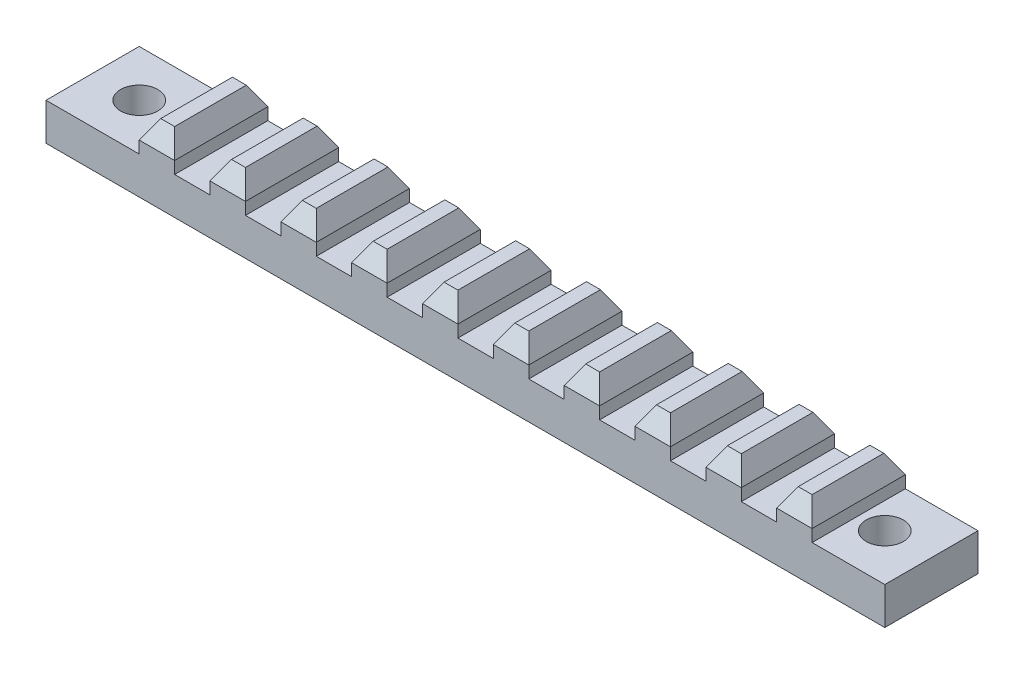
from build123d import *

# Parameters (mm, degrees)
SKETCH1_W                    = 45
SKETCH1_H                    = 5
SKETCH1_R                    = 1
BOSS_EXTRUDE1_DEPTH          = 2
SKETCH2_W                    = 1.9
SKETCH2_H                    = 1.65
BOSS_EXTRUDE2_DEPTH          = 5
CHAMFER1_SIZE                = 1
CHAMFER1_SIZE_2              = 0.577350269
LPATTERN1_COUNT              = 10
LPATTERN1_PITCH              = 3.8
CHAMFER1_OF_LPATTERN1_SIZE   = 1
CHAMFER1_OF_LPATTERN1_SIZE_2 = 0.577350269


with BuildPart() as part:
    # Sketch1 → Boss-Extrude1 (new body)
    with BuildSketch(Plane(origin=(0, 0, 0), x_dir=(1, 0, 0), z_dir=(0, 1, 0))):
        with Locations((22.5, -2.5)):
            Rectangle(SKETCH1_W, SKETCH1_H)
        with Locations(Location((2.5, -2.5, 0), (0, 0, 270))):
            Circle(SKETCH1_R, mode=Mode.SUBTRACT)
        with Locations(Location((42.5, -2.5, 0), (0, 0, 270))):
            Circle(SKETCH1_R, mode=Mode.SUBTRACT)
    extrude(amount=BOSS_EXTRUDE1_DEPTH)

    # Sketch2 → Boss-Extrude2 (add)
    with BuildSketch(Plane.XY.offset(5)):
        with Locations((5.95, 2.825)):
            Rectangle(SKETCH2_W, SKETCH2_H)
    boss_extrude2 = extrude(amount=-BOSS_EXTRUDE2_DEPTH)

    # Chamfer1
    # the kernel refuses this chamfer: 1, 0.577350269 mm, written as the material it takes off along each edge
    with BuildSketch(Plane(origin=(2.412914245, 3.65, 0), x_dir=(0, -0.9998132206222079, -0.019326765612700737), z_dir=(1, 0, 0))) as chamfer1_piece_1:
        Polygon((CHAMFER1_SIZE * 0.999813220622, -CHAMFER1_SIZE * 0.0193267656127), (-CHAMFER1_SIZE_2 * 0.019326765619, -CHAMFER1_SIZE_2 * 0.999813220951), (0, 0), align=None)
    extrude(amount=7.074171509, mode=Mode.SUBTRACT)
    with BuildSketch(Plane(origin=(2.412914245, 3.65, 5), x_dir=(0, -0.9998132206222079, 0.01932676561270115), z_dir=(1, 0, 0))) as chamfer1_piece_2:
        Polygon((CHAMFER1_SIZE * 0.999813220622, CHAMFER1_SIZE * 0.0193267656127), (-CHAMFER1_SIZE_2 * 0.019326765619, CHAMFER1_SIZE_2 * 0.999813220951), (0, 0), align=None)
    extrude(amount=7.074171509, mode=Mode.SUBTRACT)
    with BuildSketch(Plane(origin=(6.9, 3.65, 7.587085755), x_dir=(-0.9983227437537925, 0.0578938624026711, 0), z_dir=(0, 0, -1))) as chamfer1_piece_3:
        Polygon((CHAMFER1_SIZE_2 * 0.998322744082, -CHAMFER1_SIZE_2 * 0.0578938624217), (-CHAMFER1_SIZE * 0.0578938624027, -CHAMFER1_SIZE * 0.998322743754), (0, 0), align=None)
    extrude(amount=10.174171509, mode=Mode.SUBTRACT)
    with BuildSketch(Plane(origin=(5, 3.65, 7.587085755), x_dir=(-0.01932676561270115, -0.9998132206222079, 0), z_dir=(0, 0, -1))) as chamfer1_piece_4:
        Polygon((CHAMFER1_SIZE * 0.999813220622, -CHAMFER1_SIZE * 0.0193267656127), (-CHAMFER1_SIZE_2 * 0.019326765619, -CHAMFER1_SIZE_2 * 0.999813220951), (0, 0), align=None)
    extrude(amount=10.174171509, mode=Mode.SUBTRACT)

    # LPattern1: Boss-Extrude2 ×10
    with Locations(*[(i * LPATTERN1_PITCH, 0, 0) for i in range(1, LPATTERN1_COUNT)]):
        add(boss_extrude2)

    # Chamfer1 of LPattern1
    # the kernel refuses this chamfer: 1, 0.577350269 mm, written as the material it takes off along each edge
    with BuildSketch(Plane(origin=(6.212914245, 3.65, 0), x_dir=(0, -0.9998132206222079, -0.019326765612700737), z_dir=(1, 0, 0)), Plane(origin=(10.012914245, 3.65, 0), x_dir=(0, -0.9998132206222079, -0.019326765612700737), z_dir=(1, 0, 0)), Plane(origin=(13.812914245, 3.65, 0), x_dir=(0, -0.9998132206222079, -0.019326765612700737), z_dir=(1, 0, 0)), Plane(origin=(17.612914245, 3.65, 0), x_dir=(0, -0.9998132206222079, -0.019326765612700737), z_dir=(1, 0, 0)), Plane(origin=(21.412914245, 3.65, 0), x_dir=(0, -0.9998132206222079, -0.019326765612700737), z_dir=(1, 0, 0)), Plane(origin=(25.212914245, 3.65, 0), x_dir=(0, -0.9998132206222079, -0.019326765612700737), z_dir=(1, 0, 0)), Plane(origin=(29.012914245, 3.65, 0), x_dir=(0, -0.9998132206222079, -0.019326765612700737), z_dir=(1, 0, 0)), Plane(origin=(32.812914245, 3.65, 0), x_dir=(0, -0.9998132206222079, -0.019326765612700737), z_dir=(1, 0, 0)), Plane(origin=(36.612914245, 3.65, 0), x_dir=(0, -0.9998132206222079, -0.019326765612700737), z_dir=(1, 0, 0))) as chamfer1_of_lpattern1_piece_1:
        Polygon((CHAMFER1_OF_LPATTERN1_SIZE * 0.999813220622, -CHAMFER1_OF_LPATTERN1_SIZE * 0.0193267656127), (-CHAMFER1_OF_LPATTERN1_SIZE_2 * 0.019326765619, -CHAMFER1_OF_LPATTERN1_SIZE_2 * 0.999813220951), (0, 0), align=None)
    extrude(amount=7.074171509, mode=Mode.SUBTRACT)
    with BuildSketch(Plane(origin=(6.212914245, 3.65, 5), x_dir=(0, 0.0578938624026711, -0.9983227437537925), z_dir=(1, 0, 0)), Plane(origin=(10.012914245, 3.65, 5), x_dir=(0, 0.0578938624026711, -0.9983227437537925), z_dir=(1, 0, 0)), Plane(origin=(13.812914245, 3.65, 5), x_dir=(0, 0.0578938624026711, -0.9983227437537925), z_dir=(1, 0, 0)), Plane(origin=(17.612914245, 3.65, 5), x_dir=(0, 0.0578938624026711, -0.9983227437537925), z_dir=(1, 0, 0)), Plane(origin=(21.412914245, 3.65, 5), x_dir=(0, 0.0578938624026711, -0.9983227437537925), z_dir=(1, 0, 0)), Plane(origin=(25.212914245, 3.65, 5), x_dir=(0, 0.0578938624026711, -0.9983227437537925), z_dir=(1, 0, 0)), Plane(origin=(29.012914245, 3.65, 5), x_dir=(0, 0.0578938624026711, -0.9983227437537925), z_dir=(1, 0, 0)), Plane(origin=(32.812914245, 3.65, 5), x_dir=(0, 0.0578938624026711, -0.9983227437537925), z_dir=(1, 0, 0))) as chamfer1_of_lpattern1_piece_2:
        Polygon((CHAMFER1_OF_LPATTERN1_SIZE_2 * 0.998322744082, -CHAMFER1_OF_LPATTERN1_SIZE_2 * 0.0578938624217), (-CHAMFER1_OF_LPATTERN1_SIZE * 0.0578938624027, -CHAMFER1_OF_LPATTERN1_SIZE * 0.998322743754), (0, 0), align=None)
    extrude(amount=7.074171509, mode=Mode.SUBTRACT)
    with BuildSketch(Plane(origin=(10.7, 3.65, 7.587085755), x_dir=(-0.9983227437537925, 0.0578938624026711, 0), z_dir=(0, 0, -1)), Plane(origin=(14.5, 3.65, 7.587085755), x_dir=(-0.9983227437537925, 0.0578938624026711, 0), z_dir=(0, 0, -1)), Plane(origin=(18.3, 3.65, 7.587085755), x_dir=(-0.9983227437537925, 0.057893862402671276, 0), z_dir=(0, 0, -1)), Plane(origin=(22.1, 3.65, 7.587085755), x_dir=(-0.9983227437537925, 0.057893862402671276, 0), z_dir=(0, 0, -1)), Plane(origin=(25.9, 3.65, 7.587085755), x_dir=(-0.9983227437537925, 0.057893862402671276, 0), z_dir=(0, 0, -1)), Plane(origin=(29.7, 3.65, 7.587085755), x_dir=(-0.9983227437537925, 0.057893862402671276, 0), z_dir=(0, 0, -1)), Plane(origin=(33.5, 3.65, 7.587085755), x_dir=(-0.9983227437537927, 0.05789386240266986, 0), z_dir=(0, 0, -1)), Plane(origin=(37.3, 3.65, 7.587085755), x_dir=(-0.9983227437537927, 0.05789386240266986, 0), z_dir=(0, 0, -1)), Plane(origin=(41.1, 3.65, 7.587085755), x_dir=(-0.9983227437537927, 0.05789386240266986, 0), z_dir=(0, 0, -1))) as chamfer1_of_lpattern1_piece_3:
        Polygon((CHAMFER1_OF_LPATTERN1_SIZE_2 * 0.998322744082, -CHAMFER1_OF_LPATTERN1_SIZE_2 * 0.0578938624217), (-CHAMFER1_OF_LPATTERN1_SIZE * 0.0578938624027, -CHAMFER1_OF_LPATTERN1_SIZE * 0.998322743754), (0, 0), align=None)
    extrude(amount=10.174171509, mode=Mode.SUBTRACT)
    with BuildSketch(Plane(origin=(8.8, 3.65, 7.587085755), x_dir=(-0.01932676561270029, -0.9998132206222079, 0), z_dir=(0, 0, -1)), Plane(origin=(12.6, 3.65, 7.587085755), x_dir=(-0.01932676561270029, -0.9998132206222079, 0), z_dir=(0, 0, -1)), Plane(origin=(16.4, 3.65, 7.587085755), x_dir=(-0.01932676561270029, -0.9998132206222079, 0), z_dir=(0, 0, -1)), Plane(origin=(20.2, 3.65, 7.587085755), x_dir=(-0.01932676561270029, -0.9998132206222079, 0), z_dir=(0, 0, -1)), Plane(origin=(24, 3.65, 7.587085755), x_dir=(-0.01932676561270029, -0.9998132206222079, 0), z_dir=(0, 0, -1)), Plane(origin=(27.8, 3.65, 7.587085755), x_dir=(-0.01932676561270029, -0.9998132206222079, 0), z_dir=(0, 0, -1)), Plane(origin=(31.6, 3.65, 7.587085755), x_dir=(-0.0193267656127003, -0.9998132206222079, 0), z_dir=(0, 0, -1)), Plane(origin=(35.4, 3.65, 7.587085755), x_dir=(-0.01932676561270373, -0.9998132206222079, 0), z_dir=(0, 0, -1)), Plane(origin=(39.2, 3.65, 7.587085755), x_dir=(-0.01932676561270373, -0.9998132206222079, 0), z_dir=(0, 0, -1))) as chamfer1_of_lpattern1_piece_4:
        Polygon((CHAMFER1_OF_LPATTERN1_SIZE * 0.999813220622, -CHAMFER1_OF_LPATTERN1_SIZE * 0.0193267656127), (-CHAMFER1_OF_LPATTERN1_SIZE_2 * 0.019326765619, -CHAMFER1_OF_LPATTERN1_SIZE_2 * 0.999813220951), (0, 0), align=None)
    extrude(amount=10.174171509, mode=Mode.SUBTRACT)
    with BuildSketch(Plane(origin=(36.612914245, 3.65, 5), x_dir=(0, -0.9998132206222079, 0.01932676561270115), z_dir=(1, 0, 0))) as chamfer1_of_lpattern1_piece_5:
        Polygon((CHAMFER1_OF_LPATTERN1_SIZE * 0.999813220622, CHAMFER1_OF_LPATTERN1_SIZE * 0.0193267656127), (-CHAMFER1_OF_LPATTERN1_SIZE_2 * 0.019326765619, CHAMFER1_OF_LPATTERN1_SIZE_2 * 0.999813220951), (0, 0), align=None)
    extrude(amount=7.074171509, mode=Mode.SUBTRACT)


solid = part.part
